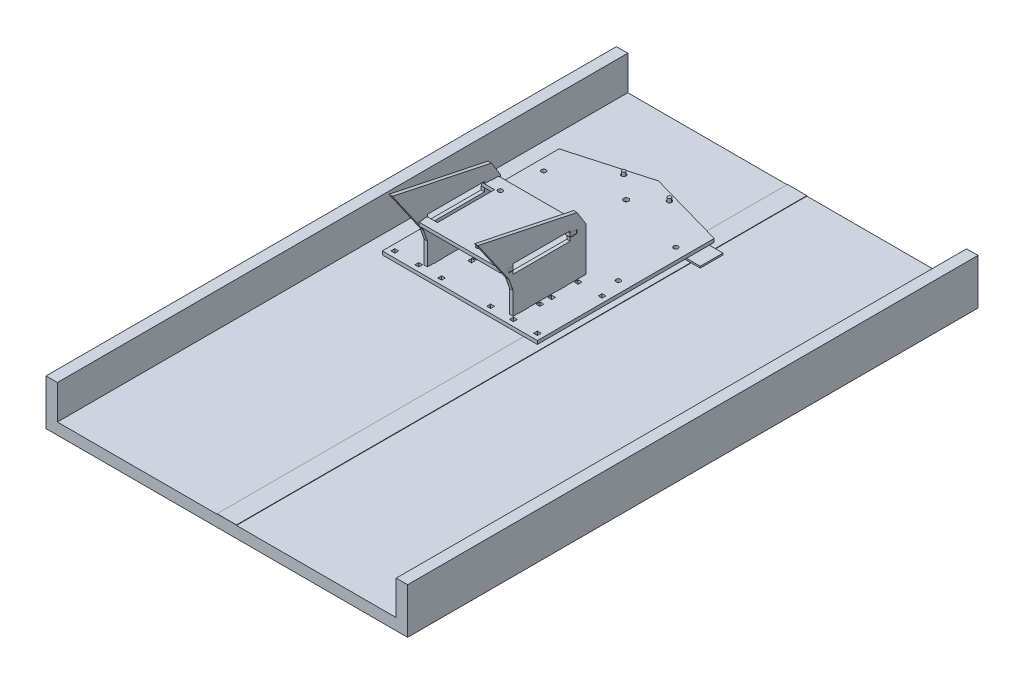
from build123d import *

# Parameters (mm, degrees)
SKETCH1_W                   = 297
SKETCH1_H                   = 10
BOSS_EXTRUDE1_DEPTH         = 250
SKETCH2_W                   = 17
SKETCH2_H                   = 0.8
BOSS_EXTRUDE2_DEPTH         = 500
BOSS_EXTRUDE3_DEPTH         = 3
CUT_EXTRUDE_THIN2_START     = -4
CUT_EXTRUDE_THIN2_OUTLINE_W = 3.4
CUT_EXTRUDE_THIN2_OUTLINE_H = 3.4
CUT_EXTRUDE_THIN2_DEPTH     = 5
CUT_EXTRUDE_THIN3_START     = -4
CUT_EXTRUDE_THIN3_OUTLINE_W = 3.4
CUT_EXTRUDE_THIN3_OUTLINE_H = 8.24
CUT_EXTRUDE_THIN3_DEPTH     = 5
BOSS_EXTRUDE4_DEPTH         = 3
SKETCH11_W                  = 69.74
SKETCH11_H                  = 3
BOSS_EXTRUDE5_DEPTH         = 71.6
SKETCH12_R                  = 2.25
CUT_EXTRUDE1_DEPTH          = 302.124332778
SKETCH13_R                  = 2
CUT_EXTRUDE2_DEPTH          = 302.124332778
SKETCH14_R                  = 2
SKETCH14_W                  = 10.5
SKETCH14_H                  = 50
CUT_EXTRUDE3_DEPTH          = 4
BOSS_EXTRUDE6_DEPTH         = 3
CUT_EXTRUDE4_DEPTH          = 95
BOSS_EXTRUDE7_DEPTH         = 3
CUT_EXTRUDE5_DEPTH          = 18
CUT_EXTRUDE5_DEPTH_BACK     = 68
SKETCH17_W                  = 50
SKETCH17_H                  = 3
SKETCH17_W_2                = 6
SKETCH17_H_2                = 0.2
SKETCH19_W                  = 5.8
SKETCH19_H                  = 3
SKETCH19_W_2                = 3.8
BOSS_EXTRUDE8_DEPTH         = 3
SKETCH20_W                  = 5.8
SKETCH20_H                  = 3
SKETCH20_W_2                = 3.8
BOSS_EXTRUDE9_DEPTH         = 3
SKETCH21_R                  = 2
CUT_EXTRUDE6_DEPTH          = 3
SKETCH23_W                  = 100
SKETCH23_H                  = 20
SKETCH23_R                  = 2
BOSS_EXTRUDE10_DEPTH        = 1.4
BOSS_EXTRUDE11_DEPTH        = 36
BOSS_EXTRUDE11_DEPTH_BACK   = 3
SKETCH24_R                  = 1.5
BOSS_EXTRUDE11_2_DEPTH      = 36
BOSS_EXTRUDE11_2_DEPTH_BACK = 3


with BuildPart() as part:
    # Sketch1 → Boss-Extrude1 (new, symmetric)
    with BuildSketch(Plane.XY):
        Rectangle(SKETCH1_W, SKETCH1_H)
        Polygon((-158.5, -5), (-148.5, -5), (-148.5, 5), (-148.5, 35), (-158.5, 35), align=None)
        Polygon((148.5, 5), (148.5, -5), (158.5, -5), (158.5, 35), (148.5, 35), align=None)
    extrude(amount=BOSS_EXTRUDE1_DEPTH, both=True)


with BuildPart() as body_2:
    # Sketch2 → Boss-Extrude2 (new body)
    with BuildSketch(Plane.XY.offset(250)):
        with Locations((0, 5)):
            Rectangle(SKETCH2_W, SKETCH2_H)
    extrude(amount=-BOSS_EXTRUDE2_DEPTH)


with BuildPart() as body_3:
    # Sketch6 → Boss-Extrude3 (new body)
    with BuildSketch(Plane(origin=(0, 0, 0), x_dir=(1, 0, 0), z_dir=(0, 1, 0))):
        Polygon((68, -45.74), (-68, -45.74), (-68, 109.26), (0, 128.5), (68, 109.26), align=None)
    extrude(amount=BOSS_EXTRUDE3_DEPTH)

    # Cut-Extrude-Thin2: read off the stored shape, not the designer's step
    # Cut-Extrude-Thin2 outline → Cut-Extrude-Thin2 (cut)
    with BuildSketch(Plane(origin=(0, 3, 0), x_dir=(1, 0, 0), z_dir=(0, 1, 0)).offset(CUT_EXTRUDE_THIN2_START)):
        with Locations((-21.5, 16.5)):
            Rectangle(CUT_EXTRUDE_THIN2_OUTLINE_W, CUT_EXTRUDE_THIN2_OUTLINE_H)
        with Locations((-21.5, -9.74)):
            Rectangle(CUT_EXTRUDE_THIN2_OUTLINE_W, CUT_EXTRUDE_THIN2_OUTLINE_H)
        with Locations((-21.5, -40.24)):
            Rectangle(CUT_EXTRUDE_THIN2_OUTLINE_W, CUT_EXTRUDE_THIN2_OUTLINE_H)
        with Locations((-21.5, -14)):
            Rectangle(CUT_EXTRUDE_THIN2_OUTLINE_W, CUT_EXTRUDE_THIN2_OUTLINE_H)
        with Locations((21.5, 16.5)):
            Rectangle(CUT_EXTRUDE_THIN2_OUTLINE_W, CUT_EXTRUDE_THIN2_OUTLINE_H)
        with Locations((62.5, 16.5)):
            Rectangle(CUT_EXTRUDE_THIN2_OUTLINE_W, CUT_EXTRUDE_THIN2_OUTLINE_H)
        with Locations((41.5, 16.5)):
            Rectangle(CUT_EXTRUDE_THIN2_OUTLINE_W, CUT_EXTRUDE_THIN2_OUTLINE_H)
        with Locations((-41.5, 16.5)):
            Rectangle(CUT_EXTRUDE_THIN2_OUTLINE_W, CUT_EXTRUDE_THIN2_OUTLINE_H)
        with Locations((-62.5, 16.5)):
            Rectangle(CUT_EXTRUDE_THIN2_OUTLINE_W, CUT_EXTRUDE_THIN2_OUTLINE_H)
        with Locations((21.5, -14)):
            Rectangle(CUT_EXTRUDE_THIN2_OUTLINE_W, CUT_EXTRUDE_THIN2_OUTLINE_H)
        with Locations((21.5, -40.24)):
            Rectangle(CUT_EXTRUDE_THIN2_OUTLINE_W, CUT_EXTRUDE_THIN2_OUTLINE_H)
        with Locations((21.5, -9.74)):
            Rectangle(CUT_EXTRUDE_THIN2_OUTLINE_W, CUT_EXTRUDE_THIN2_OUTLINE_H)
        with Locations((62.5, -40.24)):
            Rectangle(CUT_EXTRUDE_THIN2_OUTLINE_W, CUT_EXTRUDE_THIN2_OUTLINE_H)
        with Locations((41.5, -6.74)):
            Rectangle(CUT_EXTRUDE_THIN2_OUTLINE_W, CUT_EXTRUDE_THIN2_OUTLINE_H)
        with Locations((41.5, -17)):
            Rectangle(CUT_EXTRUDE_THIN2_OUTLINE_W, CUT_EXTRUDE_THIN2_OUTLINE_H)
        with Locations((41.5, -40.24)):
            Rectangle(CUT_EXTRUDE_THIN2_OUTLINE_W, CUT_EXTRUDE_THIN2_OUTLINE_H)
        with Locations((-41.5, -17)):
            Rectangle(CUT_EXTRUDE_THIN2_OUTLINE_W, CUT_EXTRUDE_THIN2_OUTLINE_H)
        with Locations((-41.5, -6.74)):
            Rectangle(CUT_EXTRUDE_THIN2_OUTLINE_W, CUT_EXTRUDE_THIN2_OUTLINE_H)
        with Locations((-41.5, -40.24)):
            Rectangle(CUT_EXTRUDE_THIN2_OUTLINE_W, CUT_EXTRUDE_THIN2_OUTLINE_H)
        with Locations((-62.5, -40.24)):
            Rectangle(CUT_EXTRUDE_THIN2_OUTLINE_W, CUT_EXTRUDE_THIN2_OUTLINE_H)
    extrude(amount=CUT_EXTRUDE_THIN2_DEPTH, mode=Mode.SUBTRACT)

    # Cut-Extrude-Thin3: read off the stored shape, not the designer's step
    # Cut-Extrude-Thin3 outline → Cut-Extrude-Thin3 (cut)
    with BuildSketch(Plane(origin=(0, 3, 0), x_dir=(1, 0, 0), z_dir=(0, 1, 0)).offset(CUT_EXTRUDE_THIN3_START)):
        with Locations((-37.5, 4.88)):
            Rectangle(CUT_EXTRUDE_THIN3_OUTLINE_W, CUT_EXTRUDE_THIN3_OUTLINE_H)
        with Locations((-37.5, -28.62)):
            Rectangle(CUT_EXTRUDE_THIN3_OUTLINE_W, CUT_EXTRUDE_THIN3_OUTLINE_H)
        with Locations((37.5, 4.88)):
            Rectangle(CUT_EXTRUDE_THIN3_OUTLINE_W, CUT_EXTRUDE_THIN3_OUTLINE_H)
        with Locations((37.5, -28.62)):
            Rectangle(CUT_EXTRUDE_THIN3_OUTLINE_W, CUT_EXTRUDE_THIN3_OUTLINE_H)
    extrude(amount=CUT_EXTRUDE_THIN3_DEPTH, mode=Mode.SUBTRACT)

    # Sketch12 → Cut-Extrude1 (cut, through all)
    with BuildSketch(Plane(origin=(0, 3, 0), x_dir=(1, 0, 0), z_dir=(0, 1, 0))):
        with Locations(Location((0, 100, 0), (0, 0, 270))):
            Circle(SKETCH12_R)
    extrude(amount=-CUT_EXTRUDE1_DEPTH, mode=Mode.SUBTRACT)

    # Sketch13 → Cut-Extrude2 (cut, through all)
    with BuildSketch(Plane(origin=(0, 3, 0), x_dir=(1, 0, 0), z_dir=(0, 1, 0))):
        with Locations(Location((-57.945, 85.74, 0), (0, 0, 270))):
            Circle(SKETCH13_R)
        with Locations(Location((-57.945, 35.26, 0), (0, 0, 270))):
            Circle(SKETCH13_R)
        with Locations(Location((57.945, 35.26, 0), (0, 0, 270))):
            Circle(SKETCH13_R)
        with Locations(Location((57.945, 85.74, 0), (0, 0, 270))):
            Circle(SKETCH13_R)
    extrude(amount=-CUT_EXTRUDE2_DEPTH, mode=Mode.SUBTRACT)

    # Sketch21 → Cut-Extrude6 (cut)
    with BuildSketch(Plane(origin=(0, 3, 0), x_dir=(1, 0, 0), z_dir=(0, 1, 0))):
        with Locations(Location((-20, 118, 0), (0, 0, 270))):
            Circle(SKETCH21_R)
        with Locations(Location((20, 118, 0), (0, 0, 270))):
            Circle(SKETCH21_R)
    extrude(amount=-CUT_EXTRUDE6_DEPTH, mode=Mode.SUBTRACT)


with BuildPart() as body_4:
    # Boss-Extrude4: read off the stored shape, not the designer's step
    # Boss-Extrude4 outline → Boss-Extrude4 (new body)
    with BuildSketch(Plane.ZY.offset(36)):
        Polygon((-26, 3), (-8.8, 3), (-8.8, 0.2), (-0.96, 0.2), (-0.96, 3), (24.7, 3), (24.7, 0.2), (32.54, 0.2), (32.54, 3), (38, 3), (38, 58.259513127), (-26, 58.259513127), align=None)
    extrude(amount=BOSS_EXTRUDE4_DEPTH)


with BuildPart() as body_5:
    # Mirror1: mirrored copy
    add(body_4.part.mirror(Plane(origin=(0, 0, 0), x_dir=(0, 0, 1), z_dir=(1, 0, 0))))


with BuildPart() as body_6:
    # Sketch11 → Boss-Extrude5 (new body)
    with BuildSketch(Plane.ZY.offset(35.8)):
        with Locations((10.87, 39.5)):
            Rectangle(SKETCH11_W, SKETCH11_H)
    extrude(amount=-BOSS_EXTRUDE5_DEPTH)

    # Sketch14 → Cut-Extrude3 (cut)
    with BuildSketch(Plane(origin=(0, 41, 0), x_dir=(1, 0, 0), z_dir=(0, 1, 0))):
        with Locations(Location((-24.063957827, 13.83000008, 0), (0, 0, 270))):
            Circle(SKETCH14_R)
        with Locations(Location((24.196042173, 12.56000008, 0), (0, 0, 270))):
            Circle(SKETCH14_R)
        with Locations(Location((8.956042173, -38.23999992, 0), (0, 0, 270))):
            Circle(SKETCH14_R)
        with Locations((32.55, -13)):
            Rectangle(SKETCH14_W, SKETCH14_H)
        with Locations((-32.55, -13)):
            Rectangle(SKETCH14_W, SKETCH14_H)
    extrude(amount=-CUT_EXTRUDE3_DEPTH, mode=Mode.SUBTRACT)

    # Sketch19 → Boss-Extrude8 (add)
    with BuildSketch(Plane.ZY.offset(35.8)):
        with Locations((-14.9, 39.5)):
            Rectangle(SKETCH19_W, SKETCH19_H)
        with Locations((39.9, 39.5)):
            Rectangle(SKETCH19_W_2, SKETCH19_H)
    extrude(amount=BOSS_EXTRUDE8_DEPTH)

    # Sketch20 → Boss-Extrude9 (add)
    with BuildSketch(Plane(origin=(35.8, 0, 0), x_dir=(0, 0, -1), z_dir=(1, 0, 0))):
        with Locations((14.9, 39.5)):
            Rectangle(SKETCH20_W, SKETCH20_H)
        with Locations((-39.9, 39.5)):
            Rectangle(SKETCH20_W_2, SKETCH20_H)
    extrude(amount=BOSS_EXTRUDE9_DEPTH)


with BuildPart() as body_4_1:
    add(body_4.part)

    # Sketch15 → Boss-Extrude6 (add)
    with BuildSketch(Plane.ZY.offset(39)):
        Polygon((41.727634326, 33.042002851), (68.872945792, 72.068400066), (3.142322189, 58.259513127), (38, 58.259513127), (38, 22.548344075), align=None)
    extrude(amount=-BOSS_EXTRUDE6_DEPTH)


with BuildPart() as cut_extrude4_tool:
    # Sketch15<3> → Cut-Extrude4 (new body)
    with BuildSketch(Plane.ZY.offset(39)):
        Polygon((-26, 58.259513127), (-26, 41), (-18, 53.817870545), (3.142322189, 58.259513127), align=None)
    extrude(amount=-CUT_EXTRUDE4_DEPTH)


with BuildPart() as body_4_2:
    add(body_4_1.part)

    # Cut-Extrude4: cut by cut_extrude4_tool
    add(cut_extrude4_tool.part, mode=Mode.SUBTRACT)


with BuildPart() as body_5_1:
    add(body_5.part)

    # Cut-Extrude4: cut by cut_extrude4_tool
    add(cut_extrude4_tool.part, mode=Mode.SUBTRACT)

    # Sketch16 → Boss-Extrude7 (add)
    with BuildSketch(Plane(origin=(39, 0, 0), x_dir=(0, 0, -1), z_dir=(1, 0, 0))):
        Polygon((-38, 58.259513127), (-3.142322189, 58.259513127), (-68.872945792, 72.068400066), (-41.727634326, 33.042002851), (-38, 22.548344075), align=None)
    extrude(amount=-BOSS_EXTRUDE7_DEPTH)


with BuildPart() as cut_extrude5_tool:
    # Sketch17 → Cut-Extrude5 (new, two sides: drawn at the far end of the back side and taken through both)
    with BuildSketch(Plane.ZY.offset(27.3).offset(-CUT_EXTRUDE5_DEPTH_BACK)):
        Polygon((-12, 37.8), (-12, 35), (38, 35), (38, 37.8), (38, 38), (-12, 38), align=None)
        with Locations((13, 39.5)):
            Rectangle(SKETCH17_W, SKETCH17_H)
        Polygon((-12, 41.2), (-12, 41), (38, 41), (38, 41.2), (38, 43), (-12, 43), align=None)
        Polygon((-18, 37.8), (-12, 37.8), (-12, 38), (-12, 41), (-18, 41), align=None)
        Polygon((38, 38), (38, 37.8), (42, 37.8), (42, 41.2), (38, 41.2), (38, 41), align=None)
        with Locations((-15, 41.1)):
            Rectangle(SKETCH17_W_2, SKETCH17_H_2)
    extrude(amount=CUT_EXTRUDE5_DEPTH + CUT_EXTRUDE5_DEPTH_BACK)


with BuildPart() as body_4_3:
    add(body_4_2.part)

    # Cut-Extrude5: cut by cut_extrude5_tool
    add(cut_extrude5_tool.part, mode=Mode.SUBTRACT)


with BuildPart() as body_5_2:
    add(body_5_1.part)

    # Cut-Extrude5: cut by cut_extrude5_tool
    add(cut_extrude5_tool.part, mode=Mode.SUBTRACT)


with BuildPart() as part_1:
    # Body-Move/Copy1: moved
    add(part.part.moved(Location((0, -70, 0))))


with BuildPart() as body_2_1:
    # Body-Move/Copy1: moved
    add(body_2.part.moved(Location((0, -70, 0))))


with BuildPart() as body_7:
    # Sketch23 → Boss-Extrude10 (new body)
    with BuildSketch(Plane(origin=(0, -30, 0), x_dir=(-1, 0, 0), z_dir=(0, -1, 0))):
        with Locations((0, 125)):
            Rectangle(SKETCH23_W, SKETCH23_H)
        with Locations(Location((20, 118, 0), (0, 0, 90))):
            Circle(SKETCH23_R, mode=Mode.SUBTRACT)
        with Locations(Location((-20, 118, 0), (0, 0, 90))):
            Circle(SKETCH23_R, mode=Mode.SUBTRACT)
    extrude(amount=BOSS_EXTRUDE10_DEPTH)


with BuildPart() as body_8:
    # Sketch24 → Boss-Extrude11 (new, two sides: drawn at the far end of the back side and taken through both)
    with BuildSketch(Plane(origin=(0, -30, 0), x_dir=(1, 0, 0), z_dir=(0, 1, 0)).offset(-BOSS_EXTRUDE11_DEPTH_BACK)):
        with Locations(Location((-20, 118, 0), (0, 0, 270))):
            Circle(SKETCH24_R)
    extrude(amount=BOSS_EXTRUDE11_DEPTH + BOSS_EXTRUDE11_DEPTH_BACK)


with BuildPart() as body_9:
    # Sketch24 → Boss-Extrude11 2 (new, two sides: drawn at the far end of the back side and taken through both)
    with BuildSketch(Plane(origin=(0, -30, 0), x_dir=(1, 0, 0), z_dir=(0, 1, 0)).offset(-BOSS_EXTRUDE11_2_DEPTH_BACK)):
        with Locations(Location((20, 118, 0), (0, 0, 270))):
            Circle(SKETCH24_R)
    extrude(amount=BOSS_EXTRUDE11_2_DEPTH + BOSS_EXTRUDE11_2_DEPTH_BACK)


solid = Compound([body_3.part, body_6.part, body_4_3.part, body_5_2.part, part_1.part, body_2_1.part, body_7.part, body_8.part, body_9.part])
